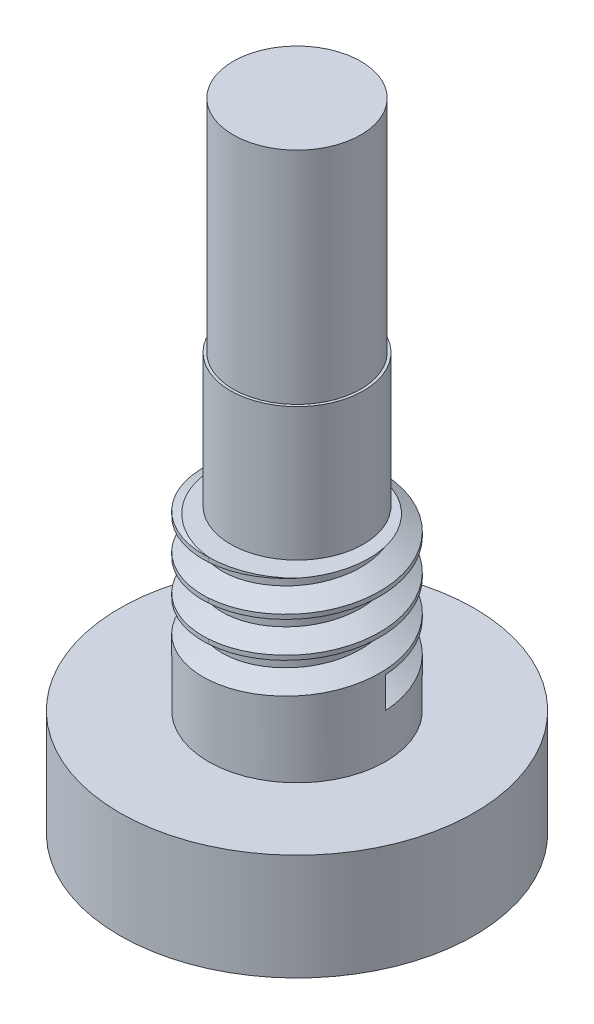
from build123d import *

# Parameters (mm, degrees)
SKETCH1_R           = 2.286
BOSS_EXTRUDE1_DEPTH = 7.88924
SKETCH2_R           = 2.38252
BOSS_EXTRUDE2_DEPTH = 4.762246
SKETCH3_R           = 3.175
BOSS_EXTRUDE3_DEPTH = 3.175
SKETCH4_R           = 3.175
BOSS_EXTRUDE4_DEPTH = 3.175
THREAD2_PITCH       = 1.27
SKETCH11_R          = 6.35
BOSS_EXTRUDE5_DEPTH = 3.81


with BuildPart() as part:
    # Sketch1 → Boss-Extrude1 (new body)
    with BuildSketch(Plane(origin=(0, 0, 0), x_dir=(1, 0, 0), z_dir=(0, 1, 0))):
        with Locations(Location((0, 0, 0), (0, 0, 270))):
            Circle(SKETCH1_R)
    extrude(amount=BOSS_EXTRUDE1_DEPTH)

    # Sketch2 → Boss-Extrude2 (add)
    with BuildSketch(Plane(origin=(0, 0, 0), x_dir=(-1, 0, 0), z_dir=(0, -1, 0))):
        with Locations(Location((0, 0, 0), (0, 0, 90))):
            Circle(SKETCH2_R)
    extrude(amount=BOSS_EXTRUDE2_DEPTH)

    # Sketch3 → Boss-Extrude3 (add)
    with BuildSketch(Plane(origin=(0, -4.762246, 0), x_dir=(-1, 0, 0), z_dir=(0, -1, 0))):
        with Locations(Location((0, 0, 0), (0, 0, 90))):
            Circle(SKETCH3_R)
    extrude(amount=BOSS_EXTRUDE3_DEPTH)

    # Sketch4 → Boss-Extrude4 (add)
    with BuildSketch(Plane(origin=(0, -7.937246, 0), x_dir=(-1, 0, 0), z_dir=(0, -1, 0))):
        with Locations(Location((0, 0, 0), (0, 0, 90))):
            Circle(SKETCH4_R)
    extrude(amount=BOSS_EXTRUDE4_DEPTH)

    # Thread2: the profile of Thread Profile3 profile screwed along a right-hand helix of 3.75 turns, 8 arcs to a turn; built about Z, then put on its axis
    thread2_z = Axis((0, 0, 0), (0, 0, 1))
    thread2_corners = [(3.1753, 0, -0.000173205), (3.1753, 0, 1.111423202), (2.487592339, 0, 0.714374998), (2.487592339, 0, 0.396874998)]
    with BuildLine(mode=Mode.PRIVATE) as thread2_profile:
        Line(thread2_corners[0], thread2_corners[1])
        Line(thread2_corners[1], thread2_corners[2])
        Line(thread2_corners[2], thread2_corners[3])
        Line(thread2_corners[3], thread2_corners[0])
    thread2_cap = Face(thread2_profile.wire())
    thread2_turn_angles = [0, 22.5, 45, 67.5, 90, 112.5, 135, 157.5, 180, 202.5, 225, 247.5, 270, 292.5, 315, 337.5, 360]
    thread2_turn_weights = [1, 0.9238795325112867, 1, 0.9238795325112867, 1, 0.9238795325112867, 1, 0.9238795325112867, 1, 0.9238795325112867, 1, 0.9238795325112867, 1, 0.9238795325112867, 1, 0.9238795325112867, 1]
    thread2_turn_rails = [Edge.make_bspline([Vector(p[0], p[1], 0).rotate(thread2_z, thread2_turn_angles[k]) / thread2_turn_weights[k] + Vector(0, 0, p[2] + THREAD2_PITCH * thread2_turn_angles[k] / 360) for k in range(17)], [0, 0, 0, 1, 1, 2, 2, 3, 3, 4, 4, 5, 5, 6, 6, 7, 7, 8, 8, 8], 2, thread2_turn_weights) for p in thread2_corners]
    thread2_turn_sides = [Face.make_surface_from_curves(thread2_turn_rails[p[0]], thread2_turn_rails[p[1]]) for p in [(0, 1), (1, 2), (2, 3), (3, 0)]]
    thread2_last_angles = [1080, 1102.5, 1125, 1147.5, 1170, 1192.5, 1215, 1237.5, 1260, 1282.5, 1305, 1327.5, 1350]
    thread2_last_weights = [1, 0.9238795325112867, 1, 0.9238795325112867, 1, 0.9238795325112867, 1, 0.9238795325112867, 1, 0.9238795325112867, 1, 0.9238795325112883, 1]
    thread2_last_rails = [Edge.make_bspline([Vector(p[0], p[1], 0).rotate(thread2_z, thread2_last_angles[k]) / thread2_last_weights[k] + Vector(0, 0, p[2] + THREAD2_PITCH * thread2_last_angles[k] / 360) for k in range(13)], [0, 0, 0, 1, 1, 2, 2, 3, 3, 4, 4, 5, 5, 6, 6, 6], 2, thread2_last_weights) for p in thread2_corners]
    thread2_last_sides = [Face.make_surface_from_curves(thread2_last_rails[p[0]], thread2_last_rails[p[1]]) for p in [(0, 1), (1, 2), (2, 3), (3, 0)]]
    thread2 = Plane(origin=(0, -9.524746, 0), x_dir=(1, 0, 0), z_dir=(0, 1, 0)) * Solid(Shell([*[p.moved(Location((0, 0, THREAD2_PITCH * i))) for i in range(3) for p in thread2_turn_sides], *thread2_last_sides, thread2_cap, thread2_cap.rotate(thread2_z, 1350).moved(Location((0, 0, THREAD2_PITCH * 1350 / 360)))]))
    add(thread2, mode=Mode.SUBTRACT)

    # Sketch11 → Boss-Extrude5 (add)
    with BuildSketch(Plane(origin=(0, -11.112246, 0), x_dir=(-1, 0, 0), z_dir=(0, -1, 0))):
        with Locations(Location((0, 0, 0), (0, 0, 270))):
            Circle(SKETCH11_R)
    extrude(amount=BOSS_EXTRUDE5_DEPTH)


solid = part.part
